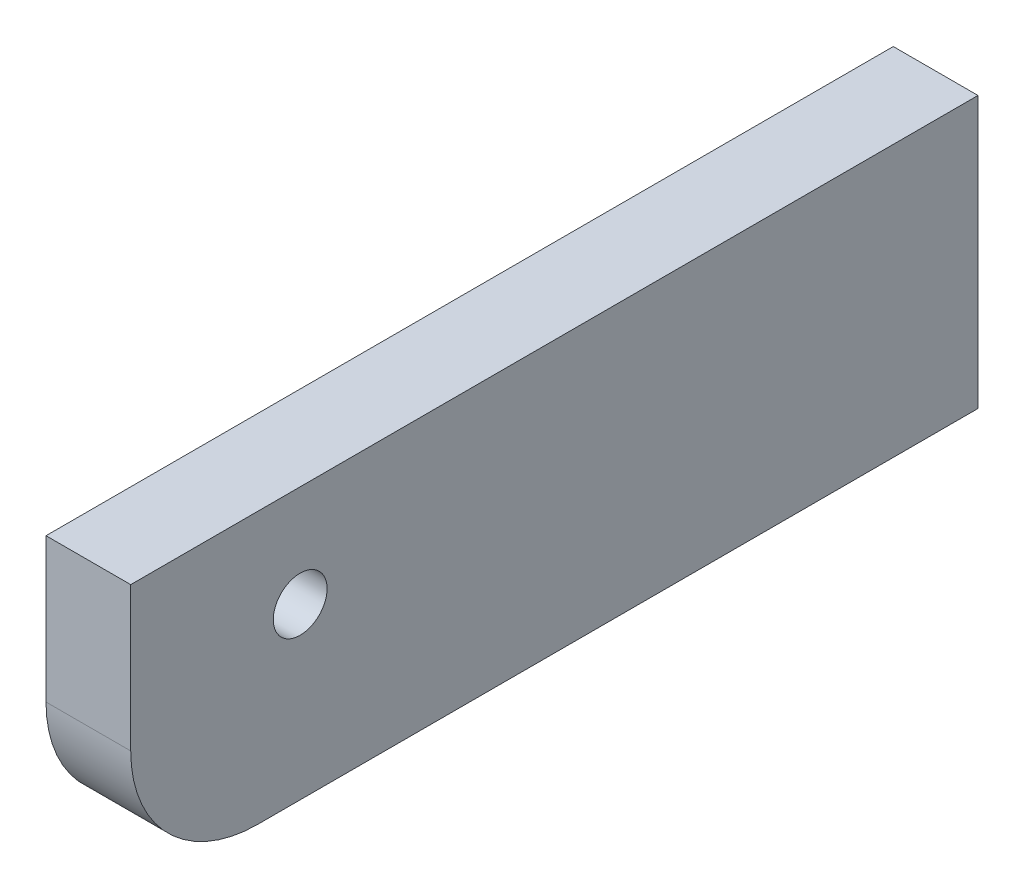
from build123d import *

# Parameters (mm, degrees)
SKETCH1_W           = 100
SKETCH1_H           = 32
SKETCH1_R           = 3.175
BOSS_EXTRUDE1_DEPTH = 10
FILLET1_R           = 15


with BuildPart() as part:
    # Sketch1 → Boss-Extrude1 (new body)
    with BuildSketch(Plane(origin=(0, 0, 0), x_dir=(0, 0, -1), z_dir=(1, 0, 0))):
        Rectangle(SKETCH1_W, SKETCH1_H)
        with Locations((-30, 4)):
            Circle(SKETCH1_R, mode=Mode.SUBTRACT)
    extrude(amount=BOSS_EXTRUDE1_DEPTH)

    # Fillet1
    fillet1_edges = [part.edges().sort_by_distance(p)[0] for p in [
        (5, -16, 50),
    ]]
    fillet(fillet1_edges, radius=FILLET1_R)


solid = part.part
